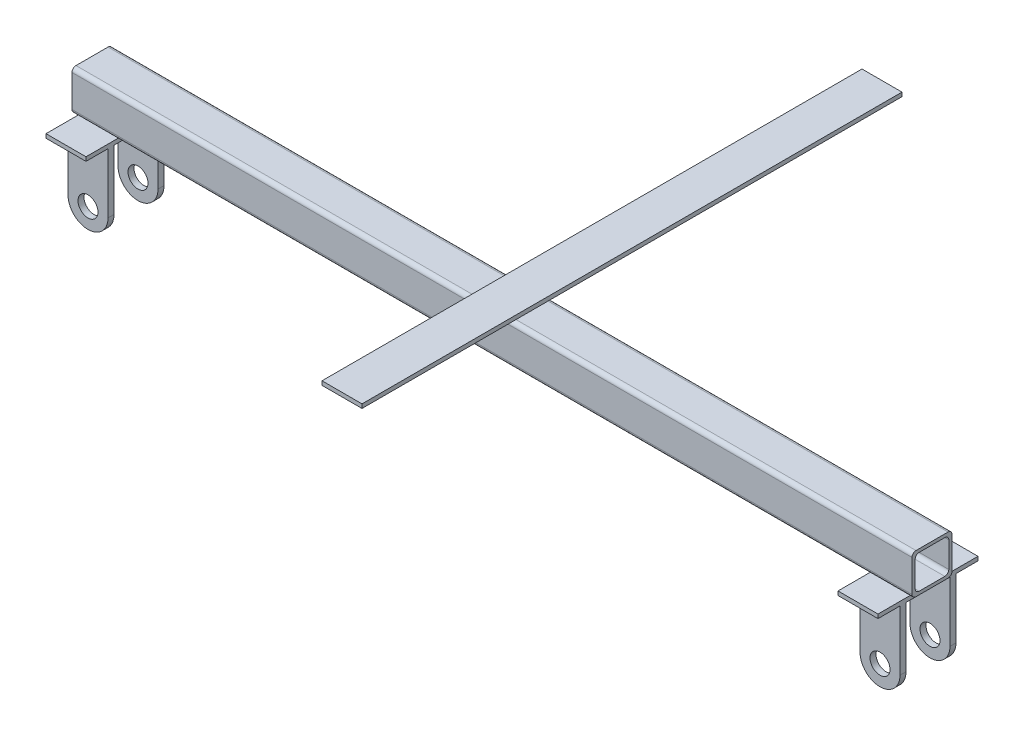
from build123d import *

# Parameters (mm, degrees)
SKETCH2_W           = 20
SKETCH2_H           = 20
SKETCH2_W_2         = 16.8
SKETCH2_H_2         = 16.8
BOSS_EXTRUDE1_DEPTH = 210
FILLET1_R           = 2
SKETCH3_W           = 20
SKETCH3_H           = 50
BOSS_EXTRUDE2_DEPTH = 2
SKETCH4_W           = 20
SKETCH4_H           = 3
BOSS_EXTRUDE3_DEPTH = 40
FILLET2_R           = 10
SKETCH5_R           = 5
CUT_EXTRUDE1_DEPTH  = 40
SKETCH6_W           = 20
SKETCH6_H           = 270
BOSS_EXTRUDE4_DEPTH = 2


with BuildPart() as part:
    # Sketch2 → Boss-Extrude1 (new, symmetric)
    with BuildSketch(Plane(origin=(0, 0, 0), x_dir=(0, 0, -1), z_dir=(1, 0, 0))):
        Rectangle(SKETCH2_W, SKETCH2_H)
        Rectangle(SKETCH2_W_2, SKETCH2_H_2, mode=Mode.SUBTRACT)
    extrude(amount=BOSS_EXTRUDE1_DEPTH, both=True)

    # Fillet1
    fillet1_edges = [part.edges().sort_by_distance(p)[0] for p in [
        (0, 8.4, 8.4),
        (0, -8.4, 8.4),
        (0, -8.4, -8.4),
        (0, 8.4, -8.4),
        (0, 10, 10),
        (0, -10, 10),
        (0, -10, -10),
        (0, 10, -10),
    ]]
    fillet(fillet1_edges, radius=FILLET1_R)

    # Sketch3 → Boss-Extrude2 (add)
    with BuildSketch(Plane.XZ.offset(10)):
        with Locations((-198, 0)):
            Rectangle(SKETCH3_W, SKETCH3_H)
        with Locations((198, 0)):
            Rectangle(SKETCH3_W, SKETCH3_H)
    extrude(amount=BOSS_EXTRUDE2_DEPTH)

    # Sketch4 → Boss-Extrude3 (add)
    with BuildSketch(Plane.XZ.offset(12)):
        with Locations((-198, 12.5)):
            Rectangle(SKETCH4_W, SKETCH4_H)
        with Locations((-198, -12.5)):
            Rectangle(SKETCH4_W, SKETCH4_H)
        with Locations((198, 12.5)):
            Rectangle(SKETCH4_W, SKETCH4_H)
        with Locations((198, -12.5)):
            Rectangle(SKETCH4_W, SKETCH4_H)
    extrude(amount=BOSS_EXTRUDE3_DEPTH)

    # Fillet2
    fillet2_edges = [part.edges().sort_by_distance(p)[0] for p in [
        (188, -52, 12.5),
        (208, -52, 12.5),
        (208, -52, -12.5),
        (188, -52, -12.5),
        (-188, -52, 12.5),
        (-188, -52, -12.5),
        (-208, -52, 12.5),
        (-208, -52, -12.5),
    ]]
    fillet(fillet2_edges, radius=FILLET2_R - 0.0001)  # a hair under: the kernel refuses the full size

    # Sketch5 → Cut-Extrude1 (cut)
    with BuildSketch(Plane.XY.offset(14)):
        with Locations((-198, -42)):
            Circle(SKETCH5_R)
        with Locations((198, -42)):
            Circle(SKETCH5_R)
    extrude(amount=-CUT_EXTRUDE1_DEPTH, mode=Mode.SUBTRACT)

    # Sketch6 → Boss-Extrude4 (add)
    with BuildSketch(Plane(origin=(0, 10, 0), x_dir=(1, 0, 0), z_dir=(0, 1, 0))):
        with Locations((0, 50)):
            Rectangle(SKETCH6_W, SKETCH6_H)
    extrude(amount=BOSS_EXTRUDE4_DEPTH)


solid = part.part
